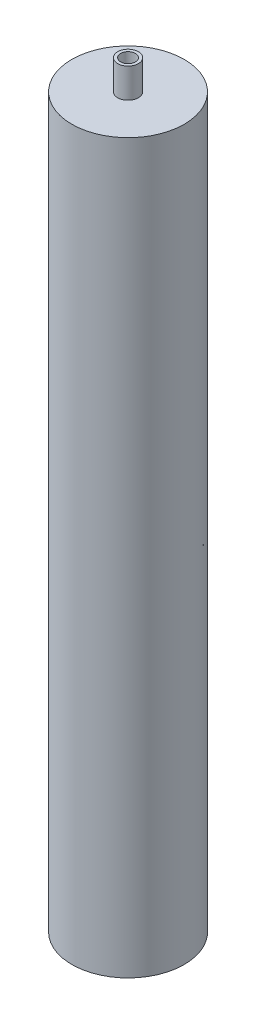
from build123d import *

# Parameters (mm, degrees)
SKETCH_1_R                  = 19
SKETCH_1_R_2                = 18
EXTRUDE_1_DEPTH             = 200
SKETCH_2_R                  = 19
SKETCH_2_R_2                = 2.5
SKETCH_2_W                  = 4.125
SKETCH_2_H                  = 6.2
EXTRUDE_2_DEPTH             = 2
SKETCH_3_R                  = 19
SKETCH_3_R_2                = 18
EXTRUDE_3_DEPTH             = 40
SKETCH_4_R                  = 19
SKETCH_4_R_2                = 2.5
EXTRUDE_4_DEPTH             = 2
SKETCH_5_R                  = 3.5
SKETCH_5_R_2                = 2.5
EXTRUDE_5_DEPTH             = 10
EXTRUDE_START               = 2
SKETCH_6_R                  = 19
SKETCH_6_R_2                = 12.5
EXTRUDE_6_DEPTH             = 2
EXTRUDE_7_REACH             = 257.417
SKETCH_7_R                  = 1.5
EXTRUDE_7_DIRECTION_2_REACH = 257.417
EXTRUDE_START_2             = 3
EXTRUDE_9_DEPTH             = 3
SKETCH_9_R                  = 18
SKETCH_9_R_2                = 2.5
EXTRUDE_10_DEPTH            = 2


with BuildPart() as part:
    # 草图1 → 凸台-拉伸1 (new body)
    with BuildSketch(Plane(origin=(0, 0, 0), x_dir=(1, 0, 0), z_dir=(0, 1, 0))):
        Circle(SKETCH_1_R)
        Circle(SKETCH_1_R_2, mode=Mode.SUBTRACT)
    extrude(amount=EXTRUDE_1_DEPTH)

    # 草图2 → 凸台-拉伸2 (add)
    with BuildSketch(Plane(origin=(0, 200, 0), x_dir=(1, 0, 0), z_dir=(0, 1, 0))):
        Circle(SKETCH_2_R)
        Circle(SKETCH_2_R_2, mode=Mode.SUBTRACT)
        with Locations((-13.5475, 3.1)):
            Rectangle(SKETCH_2_W, SKETCH_2_H, mode=Mode.SUBTRACT)
    extrude(amount=EXTRUDE_2_DEPTH)

    # 草图3 → 凸台-拉伸3 (add)
    with BuildSketch(Plane(origin=(0, 202, 0), x_dir=(1, 0, 0), z_dir=(0, 1, 0))):
        Circle(SKETCH_3_R)
        Circle(SKETCH_3_R_2, mode=Mode.SUBTRACT)
    extrude(amount=EXTRUDE_3_DEPTH)

    # 草图4 → 凸台-拉伸4 (add)
    with BuildSketch(Plane(origin=(0, 242, 0), x_dir=(1, 0, 0), z_dir=(0, 1, 0))):
        Circle(SKETCH_4_R)
        Circle(SKETCH_4_R_2, mode=Mode.SUBTRACT)
    extrude(amount=EXTRUDE_4_DEPTH)

    # 草图5 → 凸台-拉伸5 (add)
    with BuildSketch(Plane(origin=(0, 244, 0), x_dir=(1, 0, 0), z_dir=(0, 1, 0))):
        Circle(SKETCH_5_R)
        Circle(SKETCH_5_R_2, mode=Mode.SUBTRACT)
    extrude(amount=EXTRUDE_5_DEPTH)

    # 草图6 → 凸台-拉伸6 (add)
    with BuildSketch(Plane.XZ.offset(EXTRUDE_START)):
        Circle(SKETCH_6_R)
        Circle(SKETCH_6_R_2, mode=Mode.SUBTRACT)
    extrude(amount=-EXTRUDE_6_DEPTH)

    # 草图7 → 凸台-拉伸7 (add, up to next)
    with BuildSketch(Plane.XY, mode=Mode.PRIVATE) as extrude_7_sk1:
        with Locations((0, 154.22)):
            Circle(SKETCH_7_R)
    extrude_7_tool1 = extrude(extrude_7_sk1.sketch, amount=-EXTRUDE_7_REACH, mode=Mode.PRIVATE) - part.part
    add(extrude_7_tool1.solids().sort_by_distance((0, 154.22, 0))[0])

    # 草图7 → 凸台-拉伸7 direction 2 (add, up to next)
    with BuildSketch(Plane.XY, mode=Mode.PRIVATE) as extrude_7_direction_2_sk1:
        with Locations((0, 154.22)):
            Circle(SKETCH_7_R)
    extrude_7_direction_2_tool1 = extrude(extrude_7_direction_2_sk1.sketch, amount=EXTRUDE_7_DIRECTION_2_REACH, mode=Mode.PRIVATE) - part.part
    add(extrude_7_direction_2_tool1.solids().sort_by_distance((0, 154.22, 0))[0])

    # 草图8 → 凸台-拉伸9 (add)
    with BuildSketch(Plane(origin=(0, 139, 0), x_dir=(-1, 0, 0), z_dir=(0, -1, 0)).offset(EXTRUDE_START_2)):
        with BuildLine():
            Line((0, 0), (-18, 0))
            ThreePointArc((-18, 0), (-17.822024245, -2.524965704), (-17.291616466, -5))
            Line((-17.291616466, -5), (0, -5))
            Line((0, -5), (0, 0))
        make_face()
    extrude(amount=-EXTRUDE_9_DEPTH)

    # 草图9 → 凸台-拉伸10 (add)
    with BuildSketch(Plane(origin=(0, 88, 0), x_dir=(-1, 0, 0), z_dir=(0, -1, 0)).offset(EXTRUDE_START)):
        Circle(SKETCH_9_R)
        Circle(SKETCH_9_R_2, mode=Mode.SUBTRACT)
    extrude(amount=-EXTRUDE_10_DEPTH)


solid = part.part
